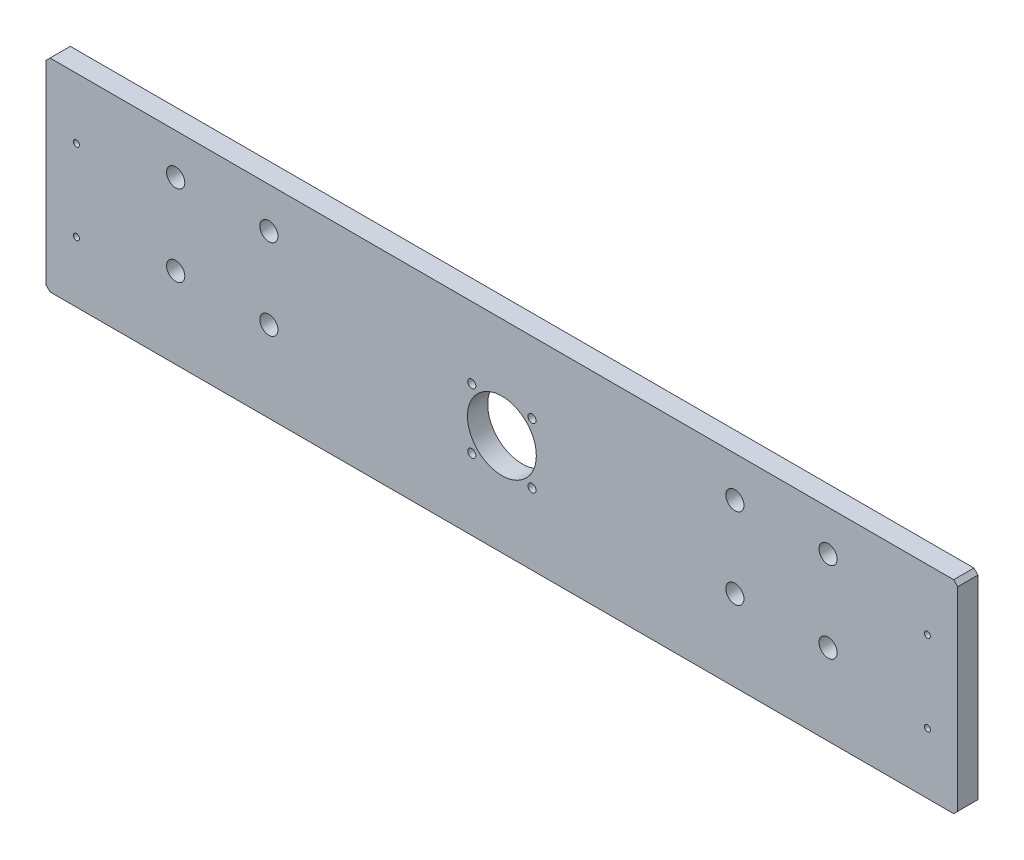
from build123d import *

# Parameters (mm, degrees)
SCHIZZO1_R                   = 17
SCHIZZO1_R_2                 = 2
SCHIZZO1_R_3                 = 4.5
SCHIZZO1_R_4                 = 1.5
ESTRUSIONE_ESTRUSIONE1_DEPTH = 10


with BuildPart() as part:
    # Schizzo1 → Estrusione-Estrusione1 (new body)
    with BuildSketch(Plane.XY):
        Polygon((2, 0), (448, 0), (450, 2), (450, 98), (448, 100), (2, 100), (0, 98), (0, 2), align=None)
        with Locations((225, 50)):
            Circle(SCHIZZO1_R, mode=Mode.SUBTRACT)
        with Locations((239.849242405, 64.849242405)):
            Circle(SCHIZZO1_R_2, mode=Mode.SUBTRACT)
        with Locations((110, 40)):
            Circle(SCHIZZO1_R_3, mode=Mode.SUBTRACT)
        with Locations((239.849242405, 35.150757595)):
            Circle(SCHIZZO1_R_2, mode=Mode.SUBTRACT)
        with Locations((210.150757595, 35.150757595)):
            Circle(SCHIZZO1_R_2, mode=Mode.SUBTRACT)
        with Locations((110, 80)):
            Circle(SCHIZZO1_R_3, mode=Mode.SUBTRACT)
        with Locations((386, 40)):
            Circle(SCHIZZO1_R_3, mode=Mode.SUBTRACT)
        with Locations((64, 40)):
            Circle(SCHIZZO1_R_3, mode=Mode.SUBTRACT)
        with Locations((64, 80)):
            Circle(SCHIZZO1_R_3, mode=Mode.SUBTRACT)
        with Locations((340, 40)):
            Circle(SCHIZZO1_R_3, mode=Mode.SUBTRACT)
        with Locations((15, 30)):
            Circle(SCHIZZO1_R_4, mode=Mode.SUBTRACT)
        with Locations((435, 30)):
            Circle(SCHIZZO1_R_4, mode=Mode.SUBTRACT)
        with Locations((210.150757595, 64.849242405)):
            Circle(SCHIZZO1_R_2, mode=Mode.SUBTRACT)
        with Locations((340, 80)):
            Circle(SCHIZZO1_R_3, mode=Mode.SUBTRACT)
        with Locations((386, 80)):
            Circle(SCHIZZO1_R_3, mode=Mode.SUBTRACT)
        with Locations((435, 70)):
            Circle(SCHIZZO1_R_4, mode=Mode.SUBTRACT)
        with Locations((15, 70)):
            Circle(SCHIZZO1_R_4, mode=Mode.SUBTRACT)
    extrude(amount=-ESTRUSIONE_ESTRUSIONE1_DEPTH)


solid = part.part
